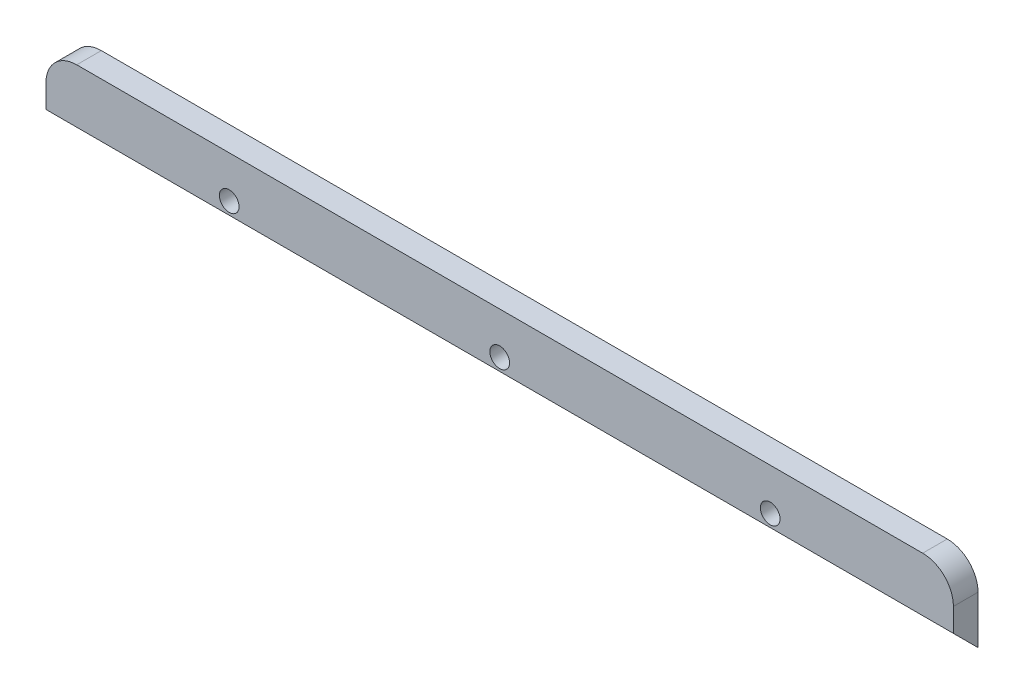
from build123d import *

# Parameters (mm, degrees)
BOSS_EXTRUDE1_DEPTH   = 36.9
M2X0_4_TAPPED_HOLE1_D = 1.6
FILLET3_R             = 2.5


with BuildPart() as part:
    # Sketch1 → Boss-Extrude1 (new, symmetric)
    with BuildSketch(Plane(origin=(0, 0, 0), x_dir=(0, 0, -1), z_dir=(1, 0, 0))):
        Polygon((0, -3.2), (-2, -1.2), (-2, 3.2), (0, 3.2), align=None)
    extrude(amount=BOSS_EXTRUDE1_DEPTH, both=True)

    # M2x0.4 Tapped Hole1 (through all)
    with Locations(Plane.XY.offset(2)):
        with Locations((22, -0.2), (0, -0.2), (-22, -0.2)):
            Hole(M2X0_4_TAPPED_HOLE1_D / 2)

    # Fillet3
    fillet3_edges = [part.edges().sort_by_distance(p)[0] for p in [
        (-36.9, 3.2, 1),
        (36.9, 3.2, 1),
    ]]
    fillet(fillet3_edges, radius=FILLET3_R)


solid = part.part
